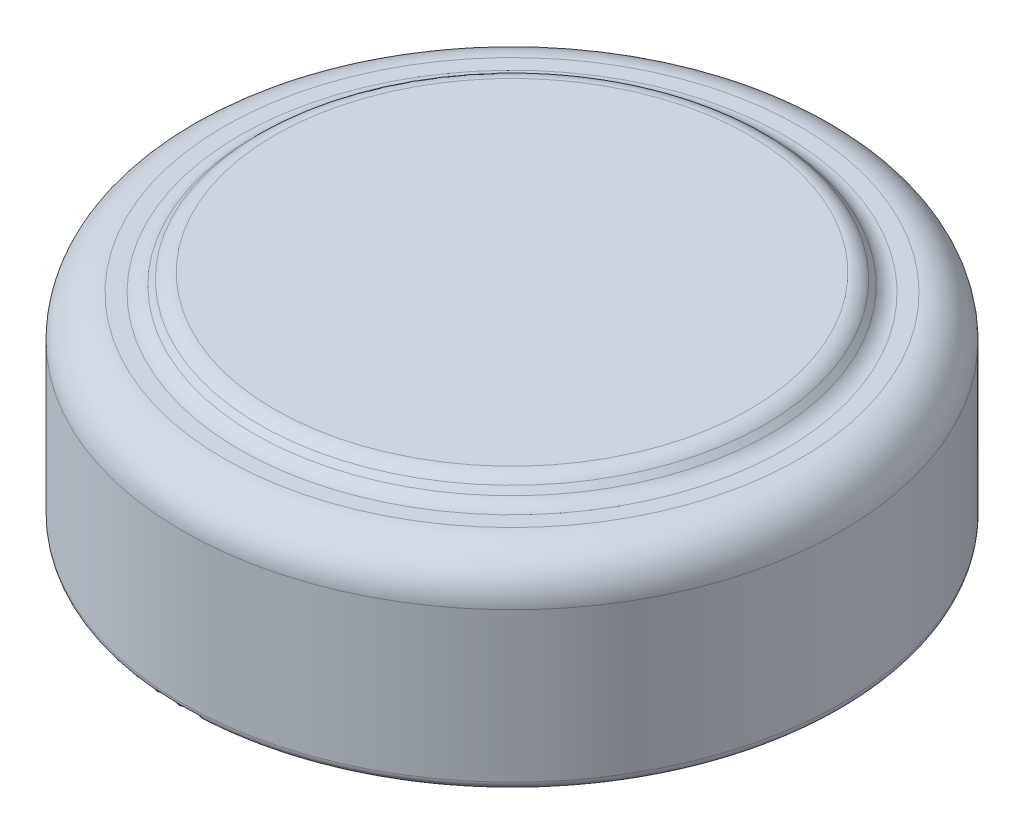
from build123d import *


with BuildPart() as part:
    # Sketch1 → Revolve1 (revolve)
    with BuildSketch(Plane.XY):
        with BuildLine():
            Line((0, 0), (-3.85, 0))
            ThreePointArc((-3.85, 0), (-3.920710678, 0.029289322), (-3.95, 0.1))
            Line((-3.95, 0.1), (-3.95, 1.89))
            ThreePointArc((-3.95, 1.89), (-3.803553391, 2.243553391), (-3.45, 2.39))
            Line((-3.45, 2.39), (-3.263553391, 2.39))
            ThreePointArc((-3.263553391, 2.39), (-3.167882533, 2.409030117), (-3.086776695, 2.463223305))
            Line((-3.086776695, 2.463223305), (-3.023223305, 2.526776695))
            ThreePointArc((-3.023223305, 2.526776695), (-2.942117467, 2.580969883), (-2.846446609, 2.6))
            Line((-2.846446609, 2.6), (0, 2.6))
            Line((0, 2.6), (0, 0))
        make_face()
    revolve(axis=Axis((0, 2.6, 0), (0, -1, 0)))


solid = part.part
